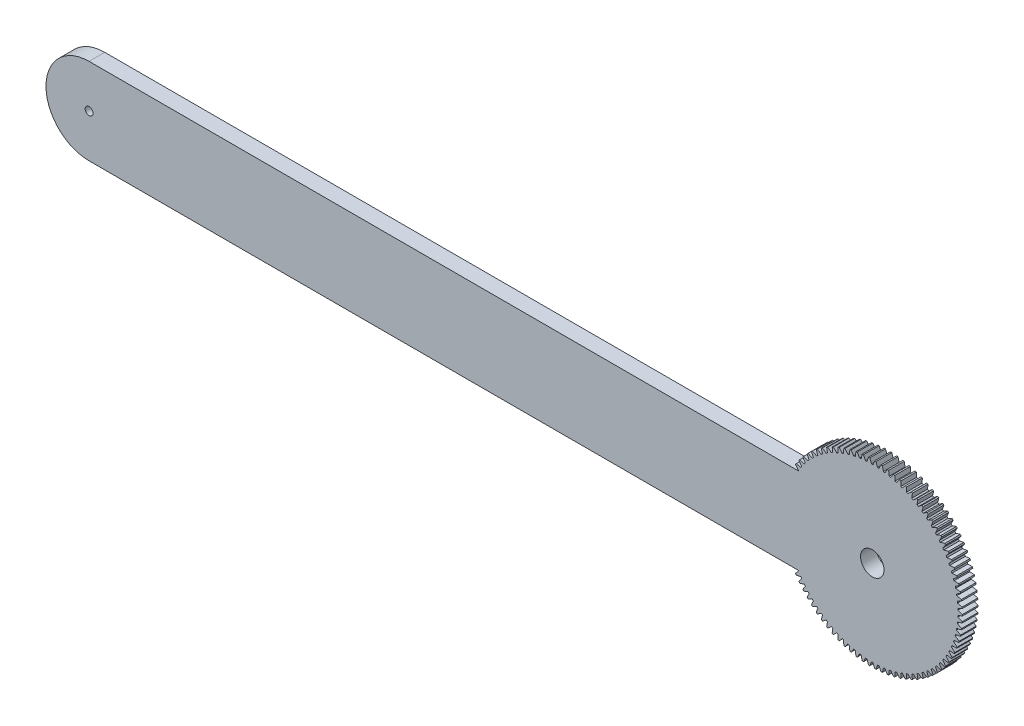
from build123d import *

# Parameters (mm, degrees)
BASPROSKE_W           = 4
BASPROSKE_H           = 23
TOOTHCUT_DEPTH        = 33.771939216
TEETHCUTS_COUNT       = 90
TEETHCUTS_ANGLE       = 356
BORSKE_R              = 5
BORE_DEPTH            = 50.0000508
BOSS_EXTRUDE1_DEPTH   = 4
SKETCH3_R             = 1
CUT_EXTRUDE2_DEPTH    = 213.286586066
SKETCH4_R             = 3
CUT_EXTRUDE4_DEPTH    = 213.286586066
BODY_MOVE_COPY1_ANGLE = 90
BODY_MOVE_COPY2_ANGLE = 180


with BuildPart() as part:
    # BasProSke → Base-Revolve (revolve)
    with BuildSketch(Plane(origin=(0, 0, 0), x_dir=(1, 0, 0), z_dir=(0, 1, 0))):
        with Locations((2, 11.5)):
            Rectangle(BASPROSKE_W, BASPROSKE_H)
    revolve(axis=Axis((-10, 0, 0), (1, 0, 0)))

    # TooCutSke → ToothCut (cut, through all)
    with BuildSketch(Plane(origin=(0, 0, 0), x_dir=(0, 0, -1), z_dir=(1, 0, 0))):
        with BuildLine():
            ThreePointArc((0.208497677, 21.873006303), (0, 21.874), (-0.208497677, 21.873006303))
            ThreePointArc((-0.208497677, 21.873006303), (-0.408932112, 22.452130021), (-0.648312723, 23.016271109))
            ThreePointArc((-0.648312723, 23.016271109), (0, 23.0254), (0.648312723, 23.016271109))
            ThreePointArc((0.648312723, 23.016271109), (0.408932112, 22.452130021), (0.208497677, 21.873006303))
        make_face()
    toothcut = extrude(amount=TOOTHCUT_DEPTH, mode=Mode.SUBTRACT)

    # TeethCuts: ToothCut ×90 about axis
    teethcuts_axis = Axis((-10, 0, 0), (1, 0, 0))
    for i in range(1, TEETHCUTS_COUNT):
        add(toothcut.rotate(teethcuts_axis, i * TEETHCUTS_ANGLE / (TEETHCUTS_COUNT - 1)), mode=Mode.SUBTRACT)

    # BorSke → Bore (cut, symmetric)
    with BuildSketch(Plane(origin=(0, 0, 0), x_dir=(0, 0, -1), z_dir=(1, 0, 0))):
        Circle(BORSKE_R)
    extrude(amount=BORE_DEPTH, both=True, mode=Mode.SUBTRACT)

    # Sketch1 → Boss-Extrude1 (add)
    with BuildSketch(Plane(origin=(0, 0, 0), x_dir=(0, 0, -1), z_dir=(1, 0, 0))):
        with BuildLine():
            Line((0, -11), (-200, -11))
            ThreePointArc((-200, -11), (-211, 0), (-200, 11))
            Line((-200, 11), (0, 11))
            ThreePointArc((0, 11), (11, 0), (0, -11))
        make_face()
    extrude(amount=BOSS_EXTRUDE1_DEPTH)

    # Sketch3 → Cut-Extrude2 (cut, through all)
    with BuildSketch(Plane(origin=(0, 0, 0), x_dir=(0, 0, -1), z_dir=(1, 0, 0))):
        with Locations((-200, 0)):
            Circle(SKETCH3_R)
    extrude(amount=CUT_EXTRUDE2_DEPTH, mode=Mode.SUBTRACT)

    # Sketch4 → Cut-Extrude4 (cut, through all)
    with BuildSketch(Plane(origin=(0, 0, 0), x_dir=(0, 0, -1), z_dir=(1, 0, 0))):
        Circle(SKETCH4_R)
    extrude(amount=CUT_EXTRUDE4_DEPTH, mode=Mode.SUBTRACT)


with BuildPart() as part_1:
    # Body-Move/Copy1: moved
    add(part.part.rotate(Axis((2, 0, 94), (0, 1, 0)), BODY_MOVE_COPY1_ANGLE))


with BuildPart() as part_2:
    # Body-Move/Copy2: moved
    add(part_1.part.rotate(Axis((2, 0, 0), (0, 0, 1)), BODY_MOVE_COPY2_ANGLE))


solid = part_2.part
